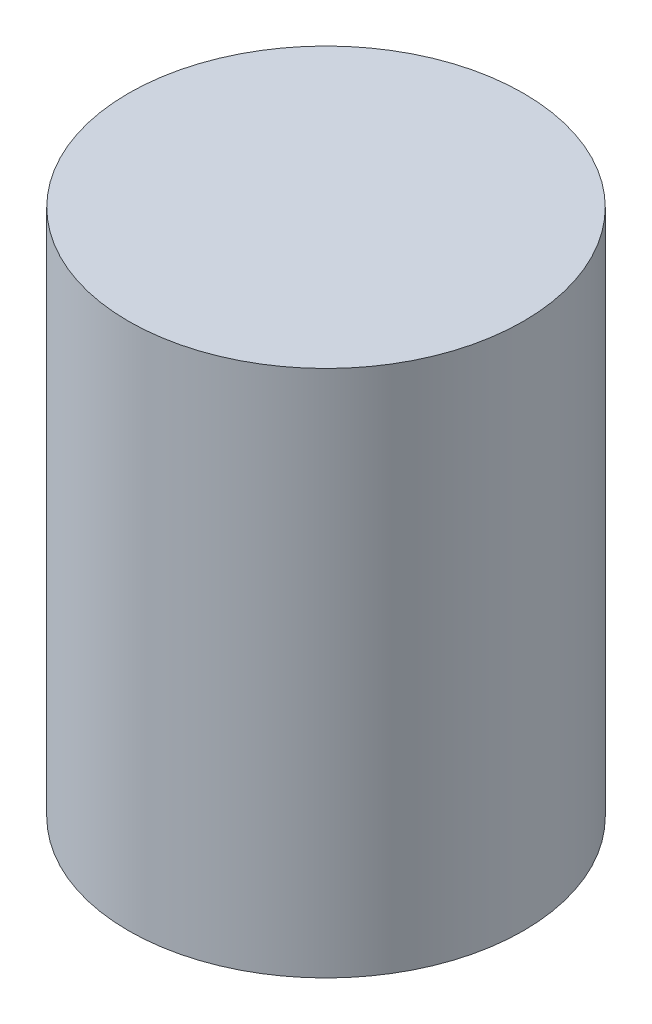
from build123d import *


with BuildPart() as part:
    # Schizzo1 → Rivoluzione1 (revolve)
    with BuildSketch(Plane.XY):
        Polygon((-18, 0), (-14, 0), (-14, 38), (0, 38), (0, 43), (-20, 43), (-20, -10.457904347), (-18, -10.457904347), align=None)
    revolve(axis=Axis((0, 0, 0), (0, 1, 0)))


solid = part.part
